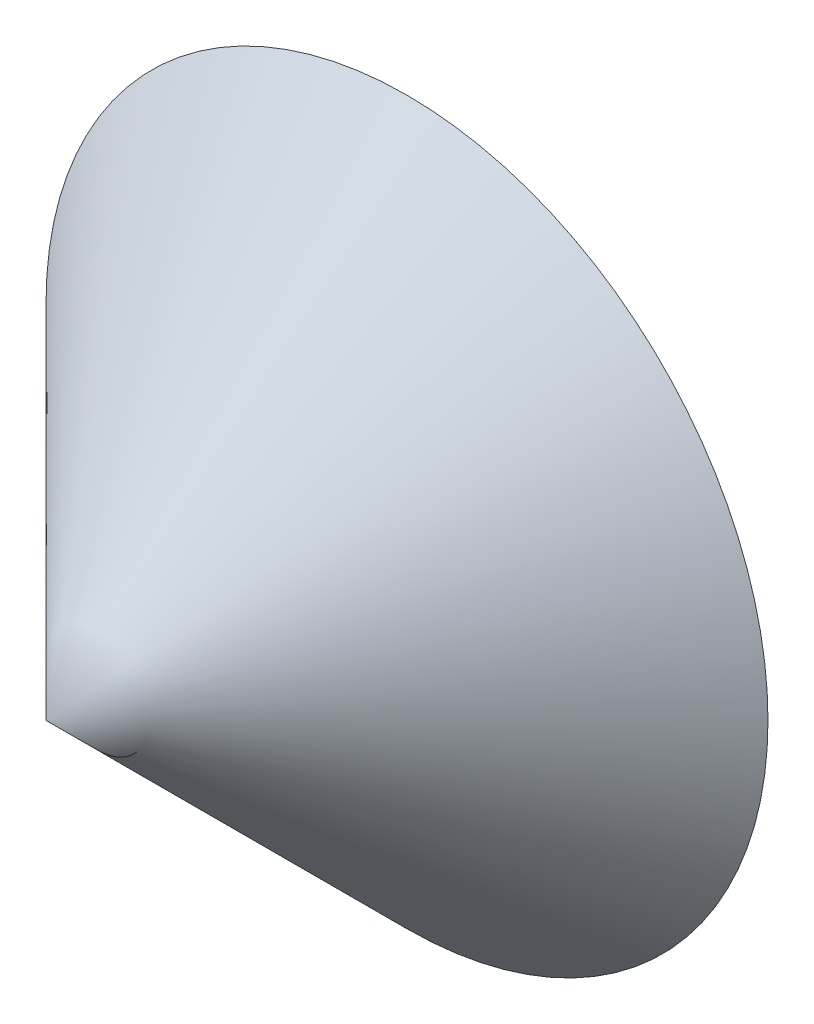
from build123d import *
from build123d.topology import SkipClean

# Parameters (mm, degrees)
SKETCH1_R           = 15
BOSS_EXTRUDE1_DEPTH = 2
SKETCH3_R           = 50
CUT_EXTRUDE1_START  = 10
CUT_EXTRUDE1_DEPTH  = 10


with BuildPart() as part:
    # Sketch1 → Boss-Extrude1 (new body)
    with BuildSketch(Plane.XY):
        Circle(SKETCH1_R)
        with BuildLine():
            ThreePointArc((5.499090834, 5.1), (0, -7.5), (-5.499090834, 5.1))
            Line((-5.499090834, 5.1), (5.499090834, 5.1))
        make_face(mode=Mode.SUBTRACT)
    extrude(amount=-BOSS_EXTRUDE1_DEPTH)

    # Sketch3 → Loft2 section 0
    with BuildSketch(Plane.XY, mode=Mode.PRIVATE) as loft2_s0:
        Circle(SKETCH3_R)
    loft([loft2_s0.sketch, Vertex(0, 0, 50)])

    # Sketch1<4> → Cut-Extrude1 (cut)
    with SkipClean():  # the faces are left unmerged after this step: merging them gives an invalid solid
        with BuildSketch(Plane.XY.offset(CUT_EXTRUDE1_START)):
            with BuildLine():
                Line((5.499090834, 5.1), (-5.499090834, 5.1))
                ThreePointArc((-5.499090834, 5.1), (0, -7.5), (5.499090834, 5.1))
            make_face()
        extrude(amount=-CUT_EXTRUDE1_DEPTH, mode=Mode.SUBTRACT)


solid = part.part
